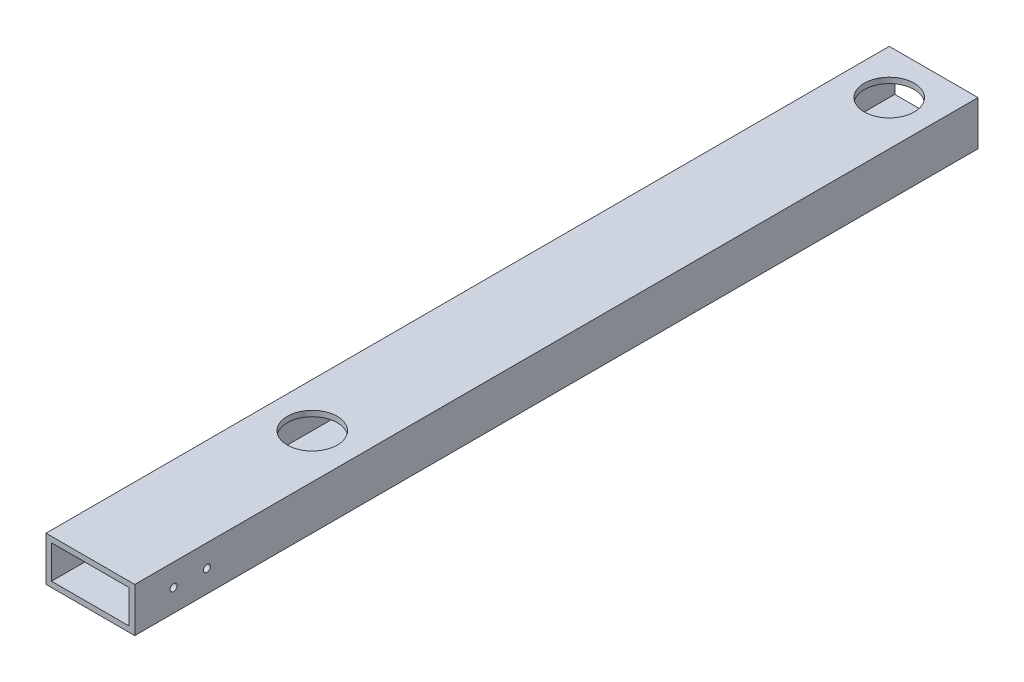
from build123d import *

# Parameters (mm, degrees)
SKETCH1_W           = 50.8
SKETCH1_H           = 25.4
BOSS_EXTRUDE1_DEPTH = 241.3
SKETCH2_W           = 44.45
SKETCH2_H           = 19.05
CUT_EXTRUDE1_DEPTH  = 484.434804291
SKETCH5_R           = 14.2875
CUT_EXTRUDE2_DEPTH  = 508
SKETCH7_R           = 14.2875
CUT_EXTRUDE4_DEPTH  = 244.959033446
SKETCH8_R           = 1.9812
CUT_EXTRUDE5_DEPTH  = 247.916220609


with BuildPart() as part:
    # Sketch1 → Boss-Extrude1 (new, symmetric)
    with BuildSketch(Plane.XY):
        Rectangle(SKETCH1_W, SKETCH1_H)
    extrude(amount=BOSS_EXTRUDE1_DEPTH, both=True)

    # Sketch2 → Cut-Extrude1 (cut, through all)
    with BuildSketch(Plane.XY.offset(241.3)):
        Rectangle(SKETCH2_W, SKETCH2_H)
    extrude(amount=-CUT_EXTRUDE1_DEPTH, mode=Mode.SUBTRACT)

    # Sketch5 → Cut-Extrude2 (cut)
    with BuildSketch(Plane(origin=(0, 12.7, 0), x_dir=(1, 0, 0), z_dir=(0, 1, 0))):
        with Locations((0, 215.9)):
            Circle(SKETCH5_R)
    extrude(amount=-CUT_EXTRUDE2_DEPTH, mode=Mode.SUBTRACT)

    # Sketch7 → Cut-Extrude4 (cut, through all)
    with BuildSketch(Plane(origin=(0, 12.7, 0), x_dir=(1, 0, 0), z_dir=(0, 1, 0))):
        with Locations((0, -114.3)):
            Circle(SKETCH7_R)
    extrude(amount=-CUT_EXTRUDE4_DEPTH, mode=Mode.SUBTRACT)

    # Sketch8 → Cut-Extrude5 (cut, through all)
    with BuildSketch(Plane(origin=(25.4, 0, 0), x_dir=(0, 0, -1), z_dir=(1, 0, 0))):
        with Locations((-219.075, 0)):
            Circle(SKETCH8_R)
        with Locations((-200.025, 0)):
            Circle(SKETCH8_R)
    extrude(amount=-CUT_EXTRUDE5_DEPTH, mode=Mode.SUBTRACT)


solid = part.part
